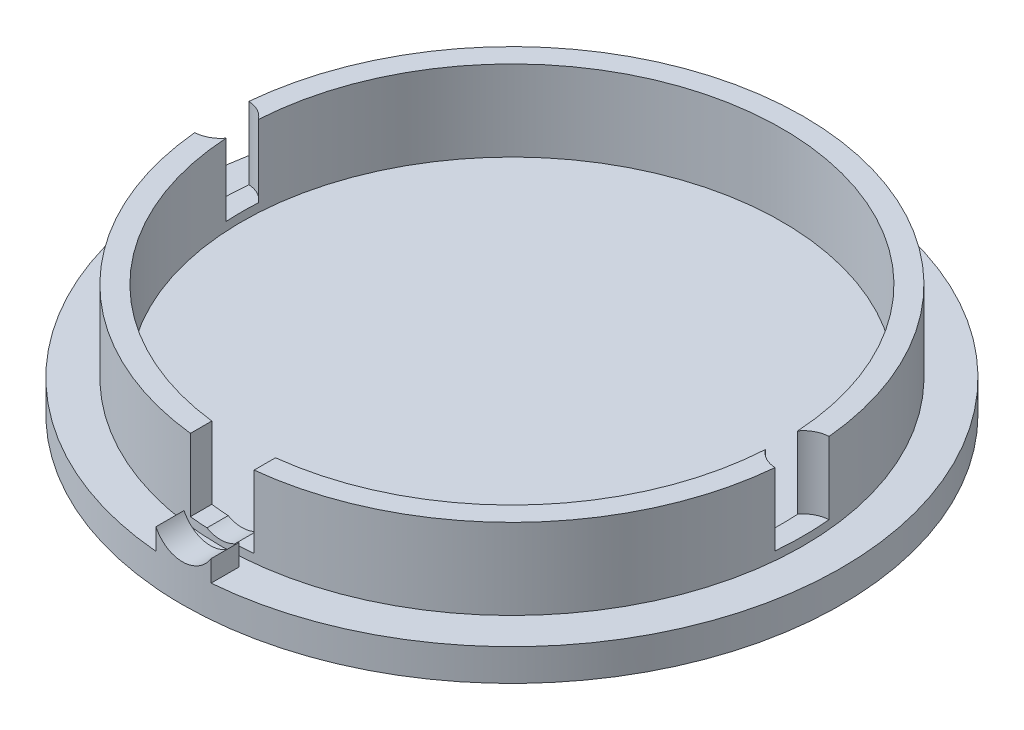
from build123d import *

# Parameters (mm, degrees)
SKETCH1_R           = 31.06
BOSS_EXTRUDE1_DEPTH = 3
SKETCH2_R           = 27.46
SKETCH2_R_2         = 25.46
BOSS_EXTRUDE2_DEPTH = 7.6
CUT_EXTRUDE1_START  = -6.8
CUT_EXTRUDE1_DEPTH  = 6.8
CUT_EXTRUDE2_START  = -6.8
CUT_EXTRUDE2_DEPTH  = 6.8
BOSS_EXTRUDE5_DEPTH = 7.6
CUT_EXTRUDE3_DEPTH  = 7.6


with BuildPart() as part:
    # Sketch1 → Boss-Extrude1 (new body)
    with BuildSketch(Plane(origin=(0, 0, 0), x_dir=(1, 0, 0), z_dir=(0, 1, 0))):
        Circle(SKETCH1_R)
    extrude(amount=BOSS_EXTRUDE1_DEPTH)

    # Sketch2 → Boss-Extrude2 (add)
    with BuildSketch(Plane(origin=(0, 3, 0), x_dir=(1, 0, 0), z_dir=(0, 1, 0))):
        Circle(SKETCH2_R)
        Circle(SKETCH2_R_2, mode=Mode.SUBTRACT)
    extrude(amount=BOSS_EXTRUDE2_DEPTH)

    # Sketch4 → Cut-Extrude1 (cut)
    with BuildSketch(Plane(origin=(0, 10.6, 0), x_dir=(1, 0, 0), z_dir=(0, 1, 0)).offset(CUT_EXTRUDE1_START)):
        with BuildLine():
            ThreePointArc((25.414433722, 1.522550032), (25.46, 0), (25.414433722, -1.522550032))
            ThreePointArc((25.414433722, -1.522550032), (26.262841127, -2.251512965), (27.34160051, -2.547249803))
            ThreePointArc((27.34160051, -2.547249803), (27.46, 0), (27.34160051, 2.547249803))
            ThreePointArc((27.34160051, 2.547249803), (26.262841127, 2.251512965), (25.414433722, 1.522550032))
        make_face()
        with BuildLine():
            ThreePointArc((-27.34160051, -2.547249803), (-26.262841127, -2.251512965), (-25.414433722, -1.522550032))
            ThreePointArc((-25.414433722, -1.522550032), (-25.46, 0), (-25.414433722, 1.522550032))
            ThreePointArc((-25.414433722, 1.522550032), (-26.262841127, 2.251512965), (-27.34160051, 2.547249803))
            ThreePointArc((-27.34160051, 2.547249803), (-27.46, 0), (-27.34160051, -2.547249803))
        make_face()
    extrude(amount=CUT_EXTRUDE1_DEPTH, mode=Mode.SUBTRACT)

    # Sketch5 → Cut-Extrude2 (cut)
    with BuildSketch(Plane(origin=(0, 10.6, 0), x_dir=(1, 0, 0), z_dir=(0, 1, 0)).offset(CUT_EXTRUDE2_START)):
        with BuildLine():
            ThreePointArc((3, -25.282634356), (0, -25.46), (-3, -25.282634356))
            Line((-3, -25.282634356), (-3, -27.29563335))
            ThreePointArc((-3, -27.29563335), (0, -27.46), (3, -27.29563335))
            Line((3, -27.29563335), (3, -25.282634356))
        make_face()
    extrude(amount=CUT_EXTRUDE2_DEPTH, mode=Mode.SUBTRACT)

    # Sketch7 → Boss-Extrude5 (add)
    with BuildSketch(Plane(origin=(0, 3, 0), x_dir=(1, 0, 0), z_dir=(0, 1, 0))):
        with BuildLine():
            Line((2.6, -28.301441659), (2.6, -30.95098706))
            ThreePointArc((2.6, -30.95098706), (0, -31.06), (-2.6, -30.95098706))
            Line((-2.6, -30.95098706), (-2.6, -28.301441659))
            ThreePointArc((-2.6, -28.301441659), (0, -28.420453674), (2.6, -28.301441659))
        make_face()
    extrude(amount=BOSS_EXTRUDE5_DEPTH)

    # Sketch8 → Cut-Extrude3 (cut)
    with BuildSketch(Plane.XY.offset(31.06)):
        with BuildLine():
            Line((2.6, 10.6), (-2.6, 10.6))
            Line((-2.6, 10.6), (-2.6, 5.003337045))
            ThreePointArc((-2.6, 5.003337045), (0, 3.5), (2.6, 5.003337045))
            Line((2.6, 5.003337045), (2.6, 10.6))
        make_face()
    extrude(amount=-CUT_EXTRUDE3_DEPTH, mode=Mode.SUBTRACT)


solid = part.part
